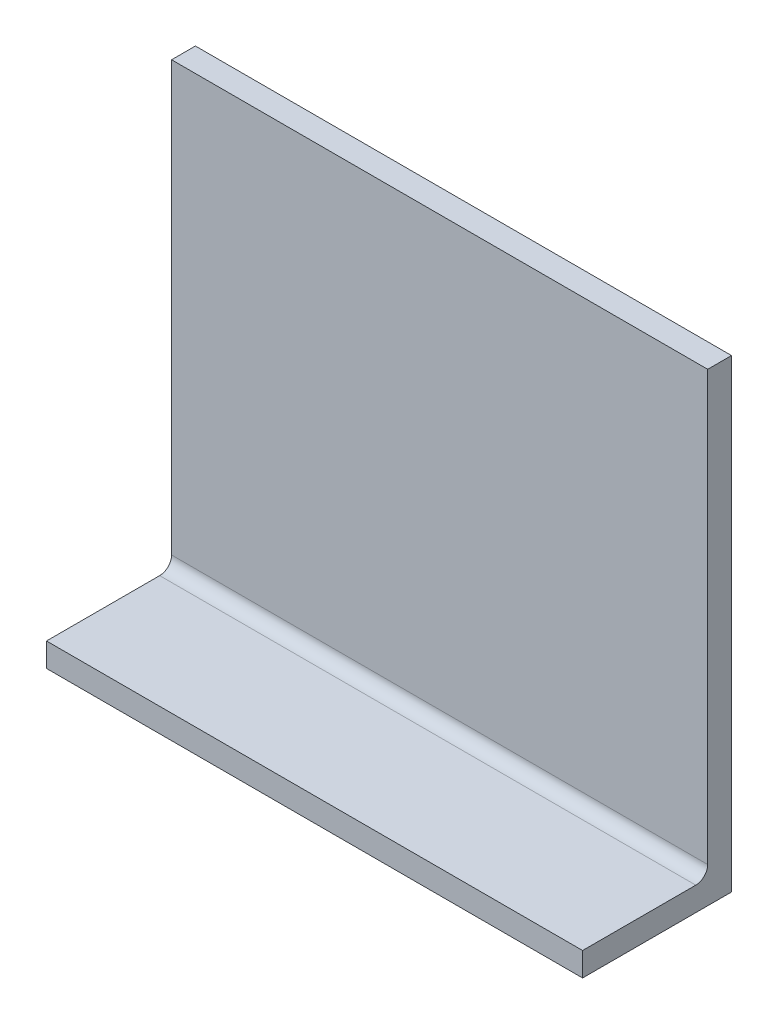
from build123d import *

# Parameters (mm, degrees)
SKETCH1_W           = 45
SKETCH1_H           = 12.5
BOSS_EXTRUDE1_DEPTH = 2
SKETCH2_W           = 45
SKETCH2_H           = 37
BOSS_EXTRUDE2_DEPTH = 2
FILLET1_R           = 1


with BuildPart() as part:
    # Sketch1 → Boss-Extrude1 (new body)
    with BuildSketch(Plane(origin=(0, 0, 0), x_dir=(1, 0, 0), z_dir=(0, 1, 0))):
        with Locations((22.5, 6.25)):
            Rectangle(SKETCH1_W, SKETCH1_H)
    extrude(amount=BOSS_EXTRUDE1_DEPTH)

    # Sketch2 → Boss-Extrude2 (add)
    with BuildSketch(Plane(origin=(0, 0, -12.5), x_dir=(-1, 0, 0), z_dir=(0, 0, -1))):
        with Locations((-22.5, 20.5)):
            Rectangle(SKETCH2_W, SKETCH2_H)
    extrude(amount=-BOSS_EXTRUDE2_DEPTH)

    # Fillet1
    fillet1_edges = [part.edges().sort_by_distance(p)[0] for p in [
        (22.5, 2, -10.5),
    ]]
    fillet(fillet1_edges, radius=FILLET1_R)


solid = part.part
